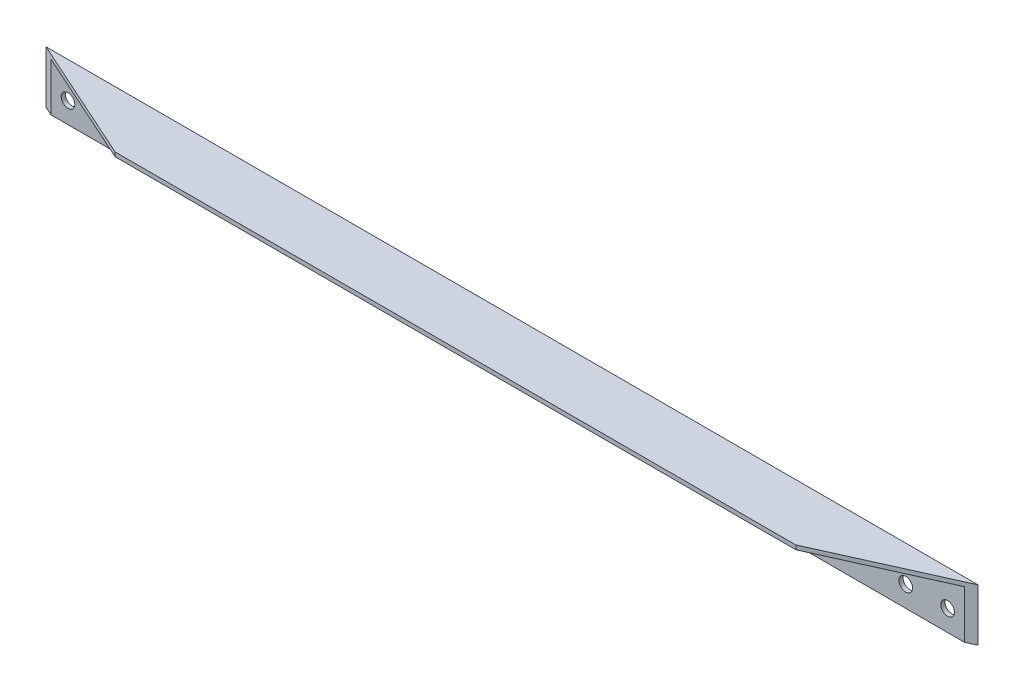
from build123d import *

# Parameters (mm, degrees)
SKETCH_1_W          = 1780
SKETCH_1_H          = 100
SKETCH_1_R          = 13
EXTRUDE_517_DEPTH   = 8
SKETCH_2_W          = 1780
SKETCH_2_H          = 8
EXTRUDE_1_DEPTH     = 100
CUT_EXTRUDE_1_DEPTH = 903.088687436


with BuildPart() as part:
    # 草图1 → Extrude 517 (new body)
    with BuildSketch(Plane.XY):
        with Locations((0, 50)):
            Rectangle(SKETCH_1_W, SKETCH_1_H)
        with Locations((840, 40)):
            Circle(SKETCH_1_R, mode=Mode.SUBTRACT)
        with Locations((760, 40)):
            Circle(SKETCH_1_R, mode=Mode.SUBTRACT)
        with Locations((-840, 40)):
            Circle(SKETCH_1_R, mode=Mode.SUBTRACT)
        with Locations((-760, 40)):
            Circle(SKETCH_1_R, mode=Mode.SUBTRACT)
    extrude(amount=EXTRUDE_517_DEPTH)

    # 草图2 → 凸台-拉伸1 (add)
    with BuildSketch(Plane.XY.offset(8)):
        with Locations((0, 96)):
            Rectangle(SKETCH_2_W, SKETCH_2_H)
    extrude(amount=EXTRUDE_1_DEPTH)

    # 草图3 → 切除-拉伸1 (cut, through all)
    with BuildSketch(Plane(origin=(0, 100, 0), x_dir=(-1, 0, 0), z_dir=(0, 1, 0))):
        Polygon((-650, 108), (-890, 0), (-890, 108), align=None)
        Polygon((890, 108), (650, 108), (890, 0), align=None)
    extrude(amount=-CUT_EXTRUDE_1_DEPTH, mode=Mode.SUBTRACT)


solid = part.part
